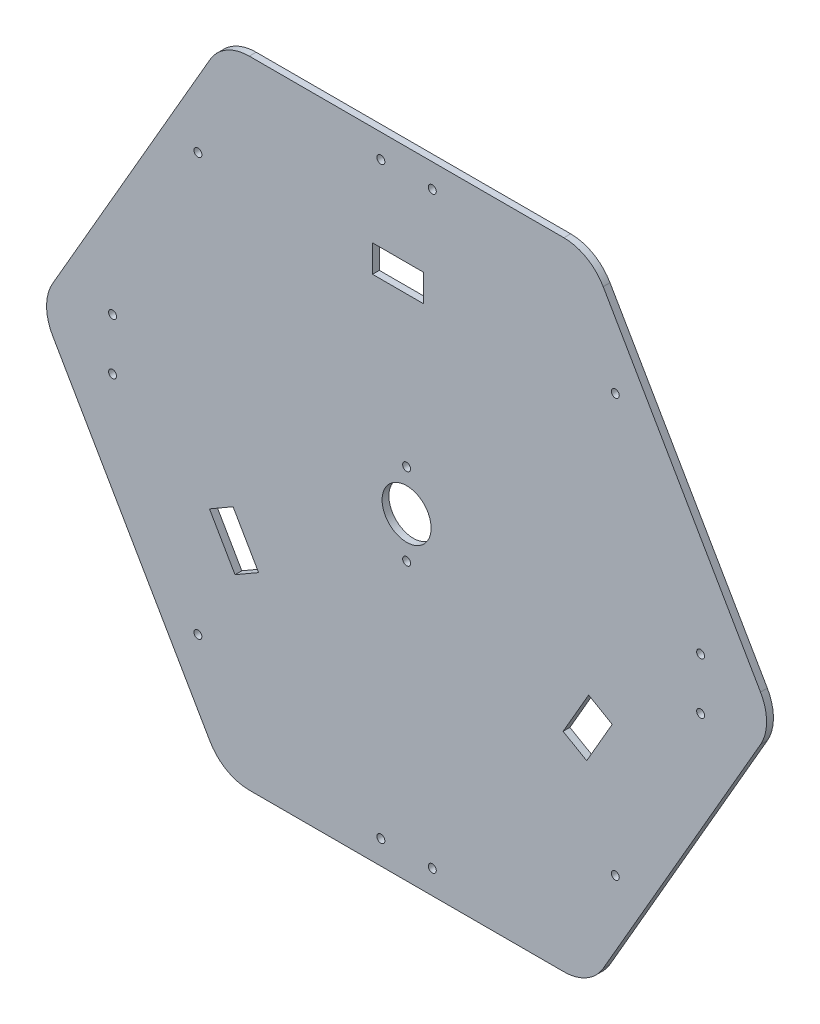
from build123d import *

# Parameters (mm, degrees)
CROQUIS1_R              = 1.75
CROQUIS1_W              = 22.5
CROQUIS1_H              = 12
CROQUIS1_R_2            = 10.8
SALIENTE_EXTRUIR1_DEPTH = 3
REDONDEO1_R             = 20
CROQUIS3_R              = 1.75
CORTAR_EXTRUIR1_DEPTH   = 212.545651301
MATRIZC1_COUNT          = 4


with BuildPart() as part:
    # Croquis1 → Saliente-Extruir1 (new body)
    with BuildSketch(Plane.XY):
        Polygon((-80.829037687, -140), (80.829037687, -140), (161.658075373, 0), (80.829037687, 140), (-80.829037687, 140), (-161.658075373, 0), align=None)
        with Locations((0, 18)):
            Circle(CROQUIS1_R, mode=Mode.SUBTRACT)
        Polygon((-65.178446292, -54.951301588), (-75.570751138, -60.951301588), (-86.820751138, -41.465730003), (-76.428446292, -35.465730003), align=None, mode=Mode.SUBTRACT)
        Polygon((80.178446292, -28.970539474), (90.570751138, -34.970539474), (79.320751138, -54.456111059), (68.928446292, -48.456111059), align=None, mode=Mode.SUBTRACT)
        with Locations((0, -18)):
            Circle(CROQUIS1_R, mode=Mode.SUBTRACT)
        with Locations((-3.75, 89.921841062)):
            Rectangle(CROQUIS1_W, CROQUIS1_H, mode=Mode.SUBTRACT)
        Circle(CROQUIS1_R_2, mode=Mode.SUBTRACT)
    extrude(amount=SALIENTE_EXTRUIR1_DEPTH)

    # Redondeo1
    redondeo1_edges = [part.edges().sort_by_distance(p)[0] for p in [
        (80.829037687, 140, 1.5),
        (-80.829037687, 140, 1.5),
        (-161.658075373, 0, 1.5),
        (-80.829037687, -140, 1.5),
        (80.829037687, -140, 1.5),
        (161.658075373, 0, 1.5),
    ]]
    fillet(redondeo1_edges, radius=REDONDEO1_R)

    # Croquis3 → Cortar-Extruir1 (cut, through all)
    with BuildSketch(Plane(origin=(0, 0, 0), x_dir=(1, 0, 0), z_dir=(0, 0, -1))):
        with Locations((129.505310752, 11.330246557)):
            Circle(CROQUIS3_R)
        with Locations((91.923881554, 91.923881554)):
            Circle(CROQUIS3_R)
        with Locations((11.330246557, 129.505310752)):
            Circle(CROQUIS3_R)
    cortar_extruir1 = extrude(amount=-CORTAR_EXTRUIR1_DEPTH, mode=Mode.SUBTRACT)

    # MatrizC1: Cortar-Extruir1 ×4 about axis
    matrizc1_axis = Axis((0, 0, 0), (0, 0, 1))
    for i in range(1, MATRIZC1_COUNT):
        add(cortar_extruir1.rotate(matrizc1_axis, i * 360 / MATRIZC1_COUNT), mode=Mode.SUBTRACT)


solid = part.part
